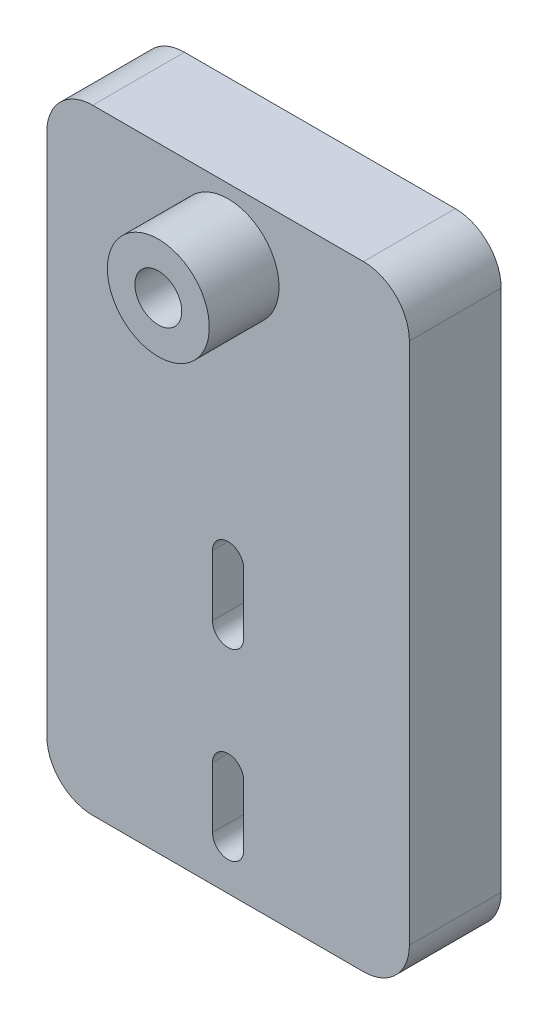
from build123d import *

# Parameters (mm, degrees)
SKETCH1_R                                    = 2.55
BOSS_EXTRUDE1_DEPTH                          = 10
SKETCH2_R                                    = 5.55
SKETCH2_R_2                                  = 2.55
BOSS_EXTRUDE2_DEPTH                          = 7.6
ENL_V_MAT_EXTRU_1_DEPTH                      = 8
RAINURE_DE_CHAMBRAGE_POUR_VIS_T_TE_RON_DEPTH = 10
RAINURE_DE_CHAMBRAGE_POUR_VIS_T_TE_3_DEPTH   = 3


# Read off the part's stored shape, not the designer's step: Rainure de chambrage pour vis à tête ronde bombée M32
with BuildPart() as part:
    # Sketch1 → Boss-Extrude1 (new body)
    with BuildSketch(Plane.XY):
        with BuildLine():
            Line((14.75, -33.5), (-14.75, -33.5))
            ThreePointArc((-14.75, -33.5), (-18.285533906, -32.035533906), (-19.75, -28.5))
            Line((-19.75, -28.5), (-19.75, 28.5))
            ThreePointArc((-19.75, 28.5), (-18.285533906, 32.035533906), (-14.75, 33.5))
            Line((-14.75, 33.5), (14.75, 33.5))
            ThreePointArc((14.75, 33.5), (18.285533906, 32.035533906), (19.75, 28.5))
            Line((19.75, 28.5), (19.75, -28.5))
            ThreePointArc((19.75, -28.5), (18.285533906, -32.035533906), (14.75, -33.5))
        make_face()
        with Locations((0, 26.5)):
            Circle(SKETCH1_R, mode=Mode.SUBTRACT)
    extrude(amount=BOSS_EXTRUDE1_DEPTH)

    # Sketch2 → Boss-Extrude2 (add)
    with BuildSketch(Plane.XY.offset(10)):
        with Locations(Location((0, 26.5, 0), (0, 0, 180))):
            Circle(SKETCH2_R)
        with Locations((0, 26.5)):
            Circle(SKETCH2_R_2, mode=Mode.SUBTRACT)
    extrude(amount=BOSS_EXTRUDE2_DEPTH)

    # Esquisse1 → Enlèv. mat.-Extru.1 (cut)
    with BuildSketch(Plane(origin=(0, 0, 0), x_dir=(-1, 0, 0), z_dir=(0, 0, -1))):
        Polygon((2.453738644, 22.25), (4.907477288, 26.5), (2.453738644, 30.75), (-2.453738644, 30.75), (-4.907477288, 26.5), (-2.453738644, 22.25), align=None)
    extrude(amount=-ENL_V_MAT_EXTRU_1_DEPTH, mode=Mode.SUBTRACT)

    # Rainure de chambrage pour vis _ t_te 2 → Rainure de chambrage pour vis à tête ronde bombée M32 (cut)
    with BuildSketch(Plane.XY):
        with BuildLine():
            ThreePointArc((1.7, -21.99), (0, -20.29), (-1.7, -21.99))
            Line((-1.7, -21.99), (-1.7, -28.59))
            ThreePointArc((-1.7, -28.59), (0, -30.29), (1.7, -28.59))
            Line((1.7, -28.59), (1.7, -21.99))
        make_face()
        with BuildLine():
            Line((1.7, -8.59), (1.7, -1.99))
            ThreePointArc((1.7, -1.99), (0, -0.29), (-1.7, -1.99))
            Line((-1.7, -1.99), (-1.7, -8.59))
            ThreePointArc((-1.7, -8.59), (0, -10.29), (1.7, -8.59))
        make_face()
    extrude(amount=RAINURE_DE_CHAMBRAGE_POUR_VIS_T_TE_RON_DEPTH, mode=Mode.SUBTRACT)

    # Rainure de chambrage pour vis _ t_te 3 o → Rainure de chambrage pour vis _ t_te 3 (cut)
    # profile 1 of 2: a face of its own
    with BuildSketch(Plane.XY):
        with BuildLine():
            ThreePointArc((3.5, -21.99), (0, -18.49), (-3.5, -21.99))
            Line((-3.5, -21.99), (-3.5, -28.59))
            ThreePointArc((-3.5, -28.59), (0, -32.09), (3.5, -28.59))
            Line((3.5, -28.59), (3.5, -21.99))
        make_face()
        with BuildLine():
            Line((-1.7, -28.59), (-1.7, -21.99))
            ThreePointArc((-1.7, -21.99), (0, -20.29), (1.7, -21.99))
            Line((1.7, -21.99), (1.7, -28.59))
            ThreePointArc((1.7, -28.59), (0, -30.29), (-1.7, -28.59))
        make_face(mode=Mode.SUBTRACT)
    # profile 2 of 2: a face of its own
    with BuildSketch(Plane.XY):
        with BuildLine():
            Line((3.5, -8.59), (3.5, -1.99))
            ThreePointArc((3.5, -1.99), (0, 1.51), (-3.5, -1.99))
            Line((-3.5, -1.99), (-3.5, -8.59))
            ThreePointArc((-3.5, -8.59), (0, -12.09), (3.5, -8.59))
        make_face()
        with BuildLine():
            ThreePointArc((-1.7, -1.99), (0, -0.29), (1.7, -1.99))
            Line((1.7, -1.99), (1.7, -8.59))
            ThreePointArc((1.7, -8.59), (0, -10.29), (-1.7, -8.59))
            Line((-1.7, -8.59), (-1.7, -1.99))
        make_face(mode=Mode.SUBTRACT)
    extrude(amount=RAINURE_DE_CHAMBRAGE_POUR_VIS_T_TE_3_DEPTH, mode=Mode.SUBTRACT)


solid = part.part
